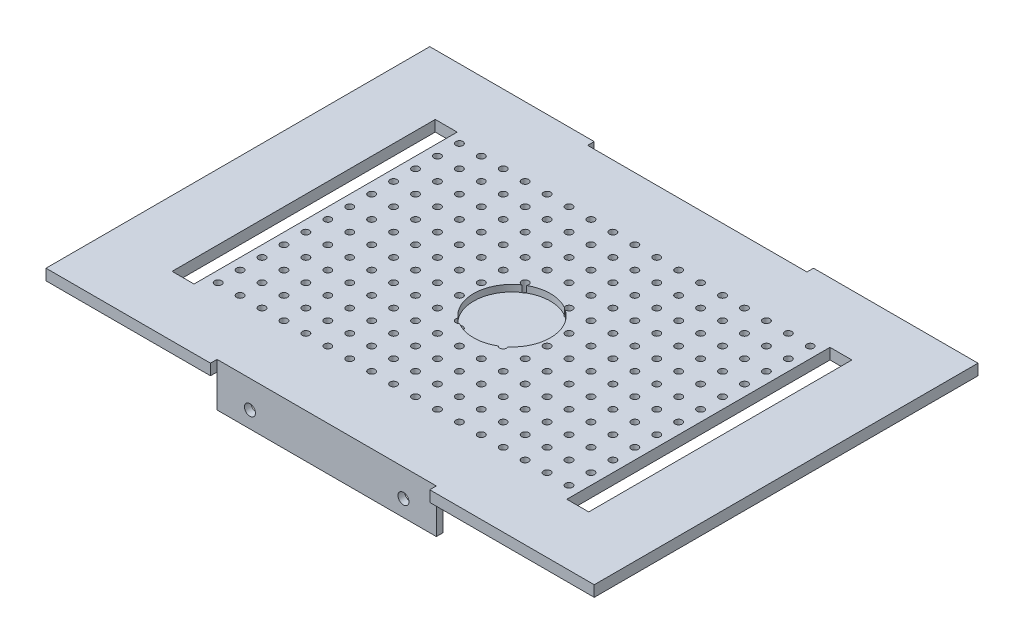
from build123d import *

# Parameters (mm, degrees)
BOSS_EXTRU_1_OUTLINE_W   = 250
BOSS_EXTRU_1_OUTLINE_H   = 175
BOSS_EXTRU_1_OUTLINE_R   = 1.6
BOSS_EXTRU_1_OUTLINE_W_2 = 10
BOSS_EXTRU_1_OUTLINE_H_2 = 120
BOSS_EXTRU_1_DEPTH       = 5
ESQUISSE2_R              = 17.5
ENL_V_MAT_EXTRU_1_DEPTH  = 3
ESQUISSE3_W              = 100
ESQUISSE3_H              = 3
ENL_V_MAT_EXTRU_2_DEPTH  = 10
ESQUISSE4_W              = 100
ESQUISSE4_H              = 3
BOSS_EXTRU_2_DEPTH       = 15
ESQUISSE5_R              = 2.5
ENL_V_MAT_EXTRU_3_DEPTH  = 247


# Read off the part's stored shape, not the designer's step: Boss.-Extru.1
with BuildPart() as part:
    # Boss.-Extru.1 outline → Boss.-Extru.1 (new body)
    with BuildSketch(Plane(origin=(0, 0, 0), x_dir=(1, 0, 0), z_dir=(0, 1, 0))):
        Rectangle(BOSS_EXTRU_1_OUTLINE_W, BOSS_EXTRU_1_OUTLINE_H)
        with Locations((-80, -54)):
            Circle(BOSS_EXTRU_1_OUTLINE_R, mode=Mode.SUBTRACT)
        with Locations((-80, -44)):
            Circle(BOSS_EXTRU_1_OUTLINE_R, mode=Mode.SUBTRACT)
        with Locations((-70, -54)):
            Circle(BOSS_EXTRU_1_OUTLINE_R, mode=Mode.SUBTRACT)
        with Locations((-70, -44)):
            Circle(BOSS_EXTRU_1_OUTLINE_R, mode=Mode.SUBTRACT)
        with Locations((-60, -54)):
            Circle(BOSS_EXTRU_1_OUTLINE_R, mode=Mode.SUBTRACT)
        with Locations((-50, -54)):
            Circle(BOSS_EXTRU_1_OUTLINE_R, mode=Mode.SUBTRACT)
        with Locations((-60, -44)):
            Circle(BOSS_EXTRU_1_OUTLINE_R, mode=Mode.SUBTRACT)
        with Locations((-50, -44)):
            Circle(BOSS_EXTRU_1_OUTLINE_R, mode=Mode.SUBTRACT)
        with Locations((-40, -54)):
            Circle(BOSS_EXTRU_1_OUTLINE_R, mode=Mode.SUBTRACT)
        with Locations((-40, -44)):
            Circle(BOSS_EXTRU_1_OUTLINE_R, mode=Mode.SUBTRACT)
        with Locations((-30, -54)):
            Circle(BOSS_EXTRU_1_OUTLINE_R, mode=Mode.SUBTRACT)
        with Locations((-20, -54)):
            Circle(BOSS_EXTRU_1_OUTLINE_R, mode=Mode.SUBTRACT)
        with Locations((-30, -44)):
            Circle(BOSS_EXTRU_1_OUTLINE_R, mode=Mode.SUBTRACT)
        with Locations((-20, -44)):
            Circle(BOSS_EXTRU_1_OUTLINE_R, mode=Mode.SUBTRACT)
        with Locations((-10, -54)):
            Circle(BOSS_EXTRU_1_OUTLINE_R, mode=Mode.SUBTRACT)
        with Locations((-10, -44)):
            Circle(BOSS_EXTRU_1_OUTLINE_R, mode=Mode.SUBTRACT)
        with Locations((-80, -34)):
            Circle(BOSS_EXTRU_1_OUTLINE_R, mode=Mode.SUBTRACT)
        with Locations((-70, -34)):
            Circle(BOSS_EXTRU_1_OUTLINE_R, mode=Mode.SUBTRACT)
        with Locations((-80, -24)):
            Circle(BOSS_EXTRU_1_OUTLINE_R, mode=Mode.SUBTRACT)
        with Locations((-70, -24)):
            Circle(BOSS_EXTRU_1_OUTLINE_R, mode=Mode.SUBTRACT)
        with Locations((-80, -14)):
            Circle(BOSS_EXTRU_1_OUTLINE_R, mode=Mode.SUBTRACT)
        with Locations((-70, -14)):
            Circle(BOSS_EXTRU_1_OUTLINE_R, mode=Mode.SUBTRACT)
        with Locations((-80, -4)):
            Circle(BOSS_EXTRU_1_OUTLINE_R, mode=Mode.SUBTRACT)
        with Locations((-70, -4)):
            Circle(BOSS_EXTRU_1_OUTLINE_R, mode=Mode.SUBTRACT)
        with Locations((-60, -34)):
            Circle(BOSS_EXTRU_1_OUTLINE_R, mode=Mode.SUBTRACT)
        with Locations((-50, -34)):
            Circle(BOSS_EXTRU_1_OUTLINE_R, mode=Mode.SUBTRACT)
        with Locations((-40, -34)):
            Circle(BOSS_EXTRU_1_OUTLINE_R, mode=Mode.SUBTRACT)
        with Locations((-60, -24)):
            Circle(BOSS_EXTRU_1_OUTLINE_R, mode=Mode.SUBTRACT)
        with Locations((-50, -24)):
            Circle(BOSS_EXTRU_1_OUTLINE_R, mode=Mode.SUBTRACT)
        with Locations((-40, -24)):
            Circle(BOSS_EXTRU_1_OUTLINE_R, mode=Mode.SUBTRACT)
        with Locations((-30, -34)):
            Circle(BOSS_EXTRU_1_OUTLINE_R, mode=Mode.SUBTRACT)
        with Locations((-20, -34)):
            Circle(BOSS_EXTRU_1_OUTLINE_R, mode=Mode.SUBTRACT)
        with Locations((-10, -34)):
            Circle(BOSS_EXTRU_1_OUTLINE_R, mode=Mode.SUBTRACT)
        with Locations((-30, -24)):
            Circle(BOSS_EXTRU_1_OUTLINE_R, mode=Mode.SUBTRACT)
        with Locations((-20, -24)):
            Circle(BOSS_EXTRU_1_OUTLINE_R, mode=Mode.SUBTRACT)
        with Locations((-10, -24)):
            Circle(BOSS_EXTRU_1_OUTLINE_R, mode=Mode.SUBTRACT)
        with Locations((-60, -14)):
            Circle(BOSS_EXTRU_1_OUTLINE_R, mode=Mode.SUBTRACT)
        with Locations((-50, -14)):
            Circle(BOSS_EXTRU_1_OUTLINE_R, mode=Mode.SUBTRACT)
        with Locations((-40, -14)):
            Circle(BOSS_EXTRU_1_OUTLINE_R, mode=Mode.SUBTRACT)
        with Locations((-60, -4)):
            Circle(BOSS_EXTRU_1_OUTLINE_R, mode=Mode.SUBTRACT)
        with Locations((-50, -4)):
            Circle(BOSS_EXTRU_1_OUTLINE_R, mode=Mode.SUBTRACT)
        with Locations((-40, -4)):
            Circle(BOSS_EXTRU_1_OUTLINE_R, mode=Mode.SUBTRACT)
        with Locations((-30, -14)):
            Circle(BOSS_EXTRU_1_OUTLINE_R, mode=Mode.SUBTRACT)
        with Locations((-20, -14)):
            Circle(BOSS_EXTRU_1_OUTLINE_R, mode=Mode.SUBTRACT)
        with Locations((-10, -14)):
            Circle(BOSS_EXTRU_1_OUTLINE_R, mode=Mode.SUBTRACT)
        with Locations((-30, -4)):
            Circle(BOSS_EXTRU_1_OUTLINE_R, mode=Mode.SUBTRACT)
        with Locations((-20, -4)):
            Circle(BOSS_EXTRU_1_OUTLINE_R, mode=Mode.SUBTRACT)
        with Locations((0, -54)):
            Circle(BOSS_EXTRU_1_OUTLINE_R, mode=Mode.SUBTRACT)
        with Locations((10, -54)):
            Circle(BOSS_EXTRU_1_OUTLINE_R, mode=Mode.SUBTRACT)
        with Locations((0, -44)):
            Circle(BOSS_EXTRU_1_OUTLINE_R, mode=Mode.SUBTRACT)
        with Locations((10, -44)):
            Circle(BOSS_EXTRU_1_OUTLINE_R, mode=Mode.SUBTRACT)
        with Locations((20, -54)):
            Circle(BOSS_EXTRU_1_OUTLINE_R, mode=Mode.SUBTRACT)
        with Locations((30, -54)):
            Circle(BOSS_EXTRU_1_OUTLINE_R, mode=Mode.SUBTRACT)
        with Locations((20, -44)):
            Circle(BOSS_EXTRU_1_OUTLINE_R, mode=Mode.SUBTRACT)
        with Locations((30, -44)):
            Circle(BOSS_EXTRU_1_OUTLINE_R, mode=Mode.SUBTRACT)
        with Locations((40, -54)):
            Circle(BOSS_EXTRU_1_OUTLINE_R, mode=Mode.SUBTRACT)
        with Locations((40, -44)):
            Circle(BOSS_EXTRU_1_OUTLINE_R, mode=Mode.SUBTRACT)
        with Locations((50, -54)):
            Circle(BOSS_EXTRU_1_OUTLINE_R, mode=Mode.SUBTRACT)
        with Locations((60, -54)):
            Circle(BOSS_EXTRU_1_OUTLINE_R, mode=Mode.SUBTRACT)
        with Locations((50, -44)):
            Circle(BOSS_EXTRU_1_OUTLINE_R, mode=Mode.SUBTRACT)
        with Locations((60, -44)):
            Circle(BOSS_EXTRU_1_OUTLINE_R, mode=Mode.SUBTRACT)
        with Locations((70, -54)):
            Circle(BOSS_EXTRU_1_OUTLINE_R, mode=Mode.SUBTRACT)
        with Locations((70, -44)):
            Circle(BOSS_EXTRU_1_OUTLINE_R, mode=Mode.SUBTRACT)
        with Locations((80, -54)):
            Circle(BOSS_EXTRU_1_OUTLINE_R, mode=Mode.SUBTRACT)
        with Locations((80, -44)):
            Circle(BOSS_EXTRU_1_OUTLINE_R, mode=Mode.SUBTRACT)
        with Locations((0, -34)):
            Circle(BOSS_EXTRU_1_OUTLINE_R, mode=Mode.SUBTRACT)
        with Locations((10, -34)):
            Circle(BOSS_EXTRU_1_OUTLINE_R, mode=Mode.SUBTRACT)
        with Locations((20, -34)):
            Circle(BOSS_EXTRU_1_OUTLINE_R, mode=Mode.SUBTRACT)
        with Locations((30, -34)):
            Circle(BOSS_EXTRU_1_OUTLINE_R, mode=Mode.SUBTRACT)
        with Locations((0, -24)):
            Circle(BOSS_EXTRU_1_OUTLINE_R, mode=Mode.SUBTRACT)
        with Locations((10, -24)):
            Circle(BOSS_EXTRU_1_OUTLINE_R, mode=Mode.SUBTRACT)
        with Locations((20, -24)):
            Circle(BOSS_EXTRU_1_OUTLINE_R, mode=Mode.SUBTRACT)
        with Locations((30, -24)):
            Circle(BOSS_EXTRU_1_OUTLINE_R, mode=Mode.SUBTRACT)
        with Locations((40, -34)):
            Circle(BOSS_EXTRU_1_OUTLINE_R, mode=Mode.SUBTRACT)
        with Locations((50, -34)):
            Circle(BOSS_EXTRU_1_OUTLINE_R, mode=Mode.SUBTRACT)
        with Locations((60, -34)):
            Circle(BOSS_EXTRU_1_OUTLINE_R, mode=Mode.SUBTRACT)
        with Locations((40, -24)):
            Circle(BOSS_EXTRU_1_OUTLINE_R, mode=Mode.SUBTRACT)
        with Locations((50, -24)):
            Circle(BOSS_EXTRU_1_OUTLINE_R, mode=Mode.SUBTRACT)
        with Locations((60, -24)):
            Circle(BOSS_EXTRU_1_OUTLINE_R, mode=Mode.SUBTRACT)
        with BuildLine():
            ThreePointArc((-1.291636361, -14.944285714), (0, -15), (1.291636361, -14.944285714))
            ThreePointArc((1.291636361, -14.944285714), (0, -15.6), (-1.291636361, -14.944285714))
        make_face(mode=Mode.SUBTRACT)
        with Locations((10, -14)):
            Circle(BOSS_EXTRU_1_OUTLINE_R, mode=Mode.SUBTRACT)
        with Locations((20, -14)):
            Circle(BOSS_EXTRU_1_OUTLINE_R, mode=Mode.SUBTRACT)
        with Locations((30, -14)):
            Circle(BOSS_EXTRU_1_OUTLINE_R, mode=Mode.SUBTRACT)
        with Locations((20, -4)):
            Circle(BOSS_EXTRU_1_OUTLINE_R, mode=Mode.SUBTRACT)
        with Locations((30, -4)):
            Circle(BOSS_EXTRU_1_OUTLINE_R, mode=Mode.SUBTRACT)
        with Locations((40, -14)):
            Circle(BOSS_EXTRU_1_OUTLINE_R, mode=Mode.SUBTRACT)
        with Locations((50, -14)):
            Circle(BOSS_EXTRU_1_OUTLINE_R, mode=Mode.SUBTRACT)
        with Locations((60, -14)):
            Circle(BOSS_EXTRU_1_OUTLINE_R, mode=Mode.SUBTRACT)
        with Locations((40, -4)):
            Circle(BOSS_EXTRU_1_OUTLINE_R, mode=Mode.SUBTRACT)
        with Locations((50, -4)):
            Circle(BOSS_EXTRU_1_OUTLINE_R, mode=Mode.SUBTRACT)
        with Locations((60, -4)):
            Circle(BOSS_EXTRU_1_OUTLINE_R, mode=Mode.SUBTRACT)
        with Locations((70, -34)):
            Circle(BOSS_EXTRU_1_OUTLINE_R, mode=Mode.SUBTRACT)
        with Locations((80, -34)):
            Circle(BOSS_EXTRU_1_OUTLINE_R, mode=Mode.SUBTRACT)
        with Locations((70, -24)):
            Circle(BOSS_EXTRU_1_OUTLINE_R, mode=Mode.SUBTRACT)
        with Locations((80, -24)):
            Circle(BOSS_EXTRU_1_OUTLINE_R, mode=Mode.SUBTRACT)
        with Locations((70, -14)):
            Circle(BOSS_EXTRU_1_OUTLINE_R, mode=Mode.SUBTRACT)
        with Locations((80, -14)):
            Circle(BOSS_EXTRU_1_OUTLINE_R, mode=Mode.SUBTRACT)
        with Locations((70, -4)):
            Circle(BOSS_EXTRU_1_OUTLINE_R, mode=Mode.SUBTRACT)
        with Locations((80, -4)):
            Circle(BOSS_EXTRU_1_OUTLINE_R, mode=Mode.SUBTRACT)
        with Locations((-90, 0)):
            Rectangle(BOSS_EXTRU_1_OUTLINE_W_2, BOSS_EXTRU_1_OUTLINE_H_2, mode=Mode.SUBTRACT)
        with Locations((-80, 6)):
            Circle(BOSS_EXTRU_1_OUTLINE_R, mode=Mode.SUBTRACT)
        with Locations((-70, 6)):
            Circle(BOSS_EXTRU_1_OUTLINE_R, mode=Mode.SUBTRACT)
        with Locations((-80, 16)):
            Circle(BOSS_EXTRU_1_OUTLINE_R, mode=Mode.SUBTRACT)
        with Locations((-70, 16)):
            Circle(BOSS_EXTRU_1_OUTLINE_R, mode=Mode.SUBTRACT)
        with Locations((-80, 26)):
            Circle(BOSS_EXTRU_1_OUTLINE_R, mode=Mode.SUBTRACT)
        with Locations((-70, 26)):
            Circle(BOSS_EXTRU_1_OUTLINE_R, mode=Mode.SUBTRACT)
        with Locations((-80, 36)):
            Circle(BOSS_EXTRU_1_OUTLINE_R, mode=Mode.SUBTRACT)
        with Locations((-70, 36)):
            Circle(BOSS_EXTRU_1_OUTLINE_R, mode=Mode.SUBTRACT)
        with Locations((-60, 6)):
            Circle(BOSS_EXTRU_1_OUTLINE_R, mode=Mode.SUBTRACT)
        with Locations((-50, 6)):
            Circle(BOSS_EXTRU_1_OUTLINE_R, mode=Mode.SUBTRACT)
        with Locations((-40, 6)):
            Circle(BOSS_EXTRU_1_OUTLINE_R, mode=Mode.SUBTRACT)
        with Locations((-60, 16)):
            Circle(BOSS_EXTRU_1_OUTLINE_R, mode=Mode.SUBTRACT)
        with Locations((-50, 16)):
            Circle(BOSS_EXTRU_1_OUTLINE_R, mode=Mode.SUBTRACT)
        with Locations((-40, 16)):
            Circle(BOSS_EXTRU_1_OUTLINE_R, mode=Mode.SUBTRACT)
        with Locations((-30, 6)):
            Circle(BOSS_EXTRU_1_OUTLINE_R, mode=Mode.SUBTRACT)
        with Locations((-20, 6)):
            Circle(BOSS_EXTRU_1_OUTLINE_R, mode=Mode.SUBTRACT)
        with Locations((-30, 16)):
            Circle(BOSS_EXTRU_1_OUTLINE_R, mode=Mode.SUBTRACT)
        with Locations((-20, 16)):
            Circle(BOSS_EXTRU_1_OUTLINE_R, mode=Mode.SUBTRACT)
        with Locations((-10, 16)):
            Circle(BOSS_EXTRU_1_OUTLINE_R, mode=Mode.SUBTRACT)
        with Locations((-60, 26)):
            Circle(BOSS_EXTRU_1_OUTLINE_R, mode=Mode.SUBTRACT)
        with Locations((-50, 26)):
            Circle(BOSS_EXTRU_1_OUTLINE_R, mode=Mode.SUBTRACT)
        with Locations((-40, 26)):
            Circle(BOSS_EXTRU_1_OUTLINE_R, mode=Mode.SUBTRACT)
        with Locations((-60, 36)):
            Circle(BOSS_EXTRU_1_OUTLINE_R, mode=Mode.SUBTRACT)
        with Locations((-50, 36)):
            Circle(BOSS_EXTRU_1_OUTLINE_R, mode=Mode.SUBTRACT)
        with Locations((-40, 36)):
            Circle(BOSS_EXTRU_1_OUTLINE_R, mode=Mode.SUBTRACT)
        with Locations((-30, 26)):
            Circle(BOSS_EXTRU_1_OUTLINE_R, mode=Mode.SUBTRACT)
        with Locations((-20, 26)):
            Circle(BOSS_EXTRU_1_OUTLINE_R, mode=Mode.SUBTRACT)
        with Locations((-10, 26)):
            Circle(BOSS_EXTRU_1_OUTLINE_R, mode=Mode.SUBTRACT)
        with Locations((-30, 36)):
            Circle(BOSS_EXTRU_1_OUTLINE_R, mode=Mode.SUBTRACT)
        with Locations((-20, 36)):
            Circle(BOSS_EXTRU_1_OUTLINE_R, mode=Mode.SUBTRACT)
        with Locations((-10, 36)):
            Circle(BOSS_EXTRU_1_OUTLINE_R, mode=Mode.SUBTRACT)
        with Locations((-80, 46)):
            Circle(BOSS_EXTRU_1_OUTLINE_R, mode=Mode.SUBTRACT)
        with Locations((-70, 46)):
            Circle(BOSS_EXTRU_1_OUTLINE_R, mode=Mode.SUBTRACT)
        with Locations((-80, 56)):
            Circle(BOSS_EXTRU_1_OUTLINE_R, mode=Mode.SUBTRACT)
        with Locations((-70, 56)):
            Circle(BOSS_EXTRU_1_OUTLINE_R, mode=Mode.SUBTRACT)
        with Locations((-60, 46)):
            Circle(BOSS_EXTRU_1_OUTLINE_R, mode=Mode.SUBTRACT)
        with Locations((-50, 46)):
            Circle(BOSS_EXTRU_1_OUTLINE_R, mode=Mode.SUBTRACT)
        with Locations((-40, 46)):
            Circle(BOSS_EXTRU_1_OUTLINE_R, mode=Mode.SUBTRACT)
        with Locations((-60, 56)):
            Circle(BOSS_EXTRU_1_OUTLINE_R, mode=Mode.SUBTRACT)
        with Locations((-50, 56)):
            Circle(BOSS_EXTRU_1_OUTLINE_R, mode=Mode.SUBTRACT)
        with Locations((-40, 56)):
            Circle(BOSS_EXTRU_1_OUTLINE_R, mode=Mode.SUBTRACT)
        with Locations((-30, 46)):
            Circle(BOSS_EXTRU_1_OUTLINE_R, mode=Mode.SUBTRACT)
        with Locations((-20, 46)):
            Circle(BOSS_EXTRU_1_OUTLINE_R, mode=Mode.SUBTRACT)
        with Locations((-10, 46)):
            Circle(BOSS_EXTRU_1_OUTLINE_R, mode=Mode.SUBTRACT)
        with Locations((-30, 56)):
            Circle(BOSS_EXTRU_1_OUTLINE_R, mode=Mode.SUBTRACT)
        with Locations((-20, 56)):
            Circle(BOSS_EXTRU_1_OUTLINE_R, mode=Mode.SUBTRACT)
        with Locations((-10, 56)):
            Circle(BOSS_EXTRU_1_OUTLINE_R, mode=Mode.SUBTRACT)
        with Locations((20, 6)):
            Circle(BOSS_EXTRU_1_OUTLINE_R, mode=Mode.SUBTRACT)
        with Locations((30, 6)):
            Circle(BOSS_EXTRU_1_OUTLINE_R, mode=Mode.SUBTRACT)
        with Locations((10, 16)):
            Circle(BOSS_EXTRU_1_OUTLINE_R, mode=Mode.SUBTRACT)
        with Locations((20, 16)):
            Circle(BOSS_EXTRU_1_OUTLINE_R, mode=Mode.SUBTRACT)
        with Locations((30, 16)):
            Circle(BOSS_EXTRU_1_OUTLINE_R, mode=Mode.SUBTRACT)
        with Locations((40, 6)):
            Circle(BOSS_EXTRU_1_OUTLINE_R, mode=Mode.SUBTRACT)
        with Locations((50, 6)):
            Circle(BOSS_EXTRU_1_OUTLINE_R, mode=Mode.SUBTRACT)
        with Locations((60, 6)):
            Circle(BOSS_EXTRU_1_OUTLINE_R, mode=Mode.SUBTRACT)
        with Locations((40, 16)):
            Circle(BOSS_EXTRU_1_OUTLINE_R, mode=Mode.SUBTRACT)
        with Locations((50, 16)):
            Circle(BOSS_EXTRU_1_OUTLINE_R, mode=Mode.SUBTRACT)
        with Locations((60, 16)):
            Circle(BOSS_EXTRU_1_OUTLINE_R, mode=Mode.SUBTRACT)
        with Locations((0, 26)):
            Circle(BOSS_EXTRU_1_OUTLINE_R, mode=Mode.SUBTRACT)
        with Locations((10, 26)):
            Circle(BOSS_EXTRU_1_OUTLINE_R, mode=Mode.SUBTRACT)
        with Locations((20, 26)):
            Circle(BOSS_EXTRU_1_OUTLINE_R, mode=Mode.SUBTRACT)
        with Locations((30, 26)):
            Circle(BOSS_EXTRU_1_OUTLINE_R, mode=Mode.SUBTRACT)
        with Locations((0, 36)):
            Circle(BOSS_EXTRU_1_OUTLINE_R, mode=Mode.SUBTRACT)
        with Locations((10, 36)):
            Circle(BOSS_EXTRU_1_OUTLINE_R, mode=Mode.SUBTRACT)
        with Locations((20, 36)):
            Circle(BOSS_EXTRU_1_OUTLINE_R, mode=Mode.SUBTRACT)
        with Locations((30, 36)):
            Circle(BOSS_EXTRU_1_OUTLINE_R, mode=Mode.SUBTRACT)
        with Locations((40, 26)):
            Circle(BOSS_EXTRU_1_OUTLINE_R, mode=Mode.SUBTRACT)
        with Locations((50, 26)):
            Circle(BOSS_EXTRU_1_OUTLINE_R, mode=Mode.SUBTRACT)
        with Locations((60, 26)):
            Circle(BOSS_EXTRU_1_OUTLINE_R, mode=Mode.SUBTRACT)
        with Locations((40, 36)):
            Circle(BOSS_EXTRU_1_OUTLINE_R, mode=Mode.SUBTRACT)
        with Locations((50, 36)):
            Circle(BOSS_EXTRU_1_OUTLINE_R, mode=Mode.SUBTRACT)
        with Locations((60, 36)):
            Circle(BOSS_EXTRU_1_OUTLINE_R, mode=Mode.SUBTRACT)
        with Locations((70, 6)):
            Circle(BOSS_EXTRU_1_OUTLINE_R, mode=Mode.SUBTRACT)
        with Locations((90, 0)):
            Rectangle(BOSS_EXTRU_1_OUTLINE_W_2, BOSS_EXTRU_1_OUTLINE_H_2, mode=Mode.SUBTRACT)
        with Locations((80, 6)):
            Circle(BOSS_EXTRU_1_OUTLINE_R, mode=Mode.SUBTRACT)
        with Locations((70, 16)):
            Circle(BOSS_EXTRU_1_OUTLINE_R, mode=Mode.SUBTRACT)
        with Locations((80, 16)):
            Circle(BOSS_EXTRU_1_OUTLINE_R, mode=Mode.SUBTRACT)
        with Locations((70, 26)):
            Circle(BOSS_EXTRU_1_OUTLINE_R, mode=Mode.SUBTRACT)
        with Locations((80, 26)):
            Circle(BOSS_EXTRU_1_OUTLINE_R, mode=Mode.SUBTRACT)
        with Locations((70, 36)):
            Circle(BOSS_EXTRU_1_OUTLINE_R, mode=Mode.SUBTRACT)
        with Locations((80, 36)):
            Circle(BOSS_EXTRU_1_OUTLINE_R, mode=Mode.SUBTRACT)
        with Locations((0, 46)):
            Circle(BOSS_EXTRU_1_OUTLINE_R, mode=Mode.SUBTRACT)
        with Locations((10, 46)):
            Circle(BOSS_EXTRU_1_OUTLINE_R, mode=Mode.SUBTRACT)
        with Locations((20, 46)):
            Circle(BOSS_EXTRU_1_OUTLINE_R, mode=Mode.SUBTRACT)
        with Locations((30, 46)):
            Circle(BOSS_EXTRU_1_OUTLINE_R, mode=Mode.SUBTRACT)
        with Locations((0, 56)):
            Circle(BOSS_EXTRU_1_OUTLINE_R, mode=Mode.SUBTRACT)
        with Locations((10, 56)):
            Circle(BOSS_EXTRU_1_OUTLINE_R, mode=Mode.SUBTRACT)
        with Locations((20, 56)):
            Circle(BOSS_EXTRU_1_OUTLINE_R, mode=Mode.SUBTRACT)
        with Locations((30, 56)):
            Circle(BOSS_EXTRU_1_OUTLINE_R, mode=Mode.SUBTRACT)
        with Locations((40, 46)):
            Circle(BOSS_EXTRU_1_OUTLINE_R, mode=Mode.SUBTRACT)
        with Locations((50, 46)):
            Circle(BOSS_EXTRU_1_OUTLINE_R, mode=Mode.SUBTRACT)
        with Locations((60, 46)):
            Circle(BOSS_EXTRU_1_OUTLINE_R, mode=Mode.SUBTRACT)
        with Locations((40, 56)):
            Circle(BOSS_EXTRU_1_OUTLINE_R, mode=Mode.SUBTRACT)
        with Locations((50, 56)):
            Circle(BOSS_EXTRU_1_OUTLINE_R, mode=Mode.SUBTRACT)
        with Locations((60, 56)):
            Circle(BOSS_EXTRU_1_OUTLINE_R, mode=Mode.SUBTRACT)
        with Locations((70, 46)):
            Circle(BOSS_EXTRU_1_OUTLINE_R, mode=Mode.SUBTRACT)
        with Locations((80, 46)):
            Circle(BOSS_EXTRU_1_OUTLINE_R, mode=Mode.SUBTRACT)
        with Locations((70, 56)):
            Circle(BOSS_EXTRU_1_OUTLINE_R, mode=Mode.SUBTRACT)
        with Locations((80, 56)):
            Circle(BOSS_EXTRU_1_OUTLINE_R, mode=Mode.SUBTRACT)
    extrude(amount=BOSS_EXTRU_1_DEPTH)

    # Esquisse2 → Enlèv. mat.-Extru.1 (cut)
    with BuildSketch(Plane(origin=(0, 5, 0), x_dir=(1, 0, 0), z_dir=(0, 1, 0))):
        Circle(ESQUISSE2_R)
    extrude(amount=-ENL_V_MAT_EXTRU_1_DEPTH, mode=Mode.SUBTRACT)

    # Esquisse3 → Enlèv. mat.-Extru.2 (cut)
    with BuildSketch(Plane(origin=(0, 5, 0), x_dir=(1, 0, 0), z_dir=(0, 1, 0))):
        with Locations((0, -86)):
            Rectangle(ESQUISSE3_W, ESQUISSE3_H)
        with Locations((0, 86)):
            Rectangle(ESQUISSE3_W, ESQUISSE3_H)
    extrude(amount=-ENL_V_MAT_EXTRU_2_DEPTH, mode=Mode.SUBTRACT)

    # Esquisse4 → Boss.-Extru.2 (add)
    with BuildSketch(Plane.XZ):
        with Locations((0, 83)):
            Rectangle(ESQUISSE4_W, ESQUISSE4_H)
        with Locations((0, -83)):
            Rectangle(ESQUISSE4_W, ESQUISSE4_H)
    extrude(amount=BOSS_EXTRU_2_DEPTH)

    # Esquisse5 → Enlèv. mat.-Extru.3 (cut)
    with BuildSketch(Plane.XY.offset(84.5)):
        with Locations((-35, -7.5)):
            Circle(ESQUISSE5_R)
        with Locations((35, -7.5)):
            Circle(ESQUISSE5_R)
    extrude(amount=-ENL_V_MAT_EXTRU_3_DEPTH, mode=Mode.SUBTRACT)


solid = part.part
